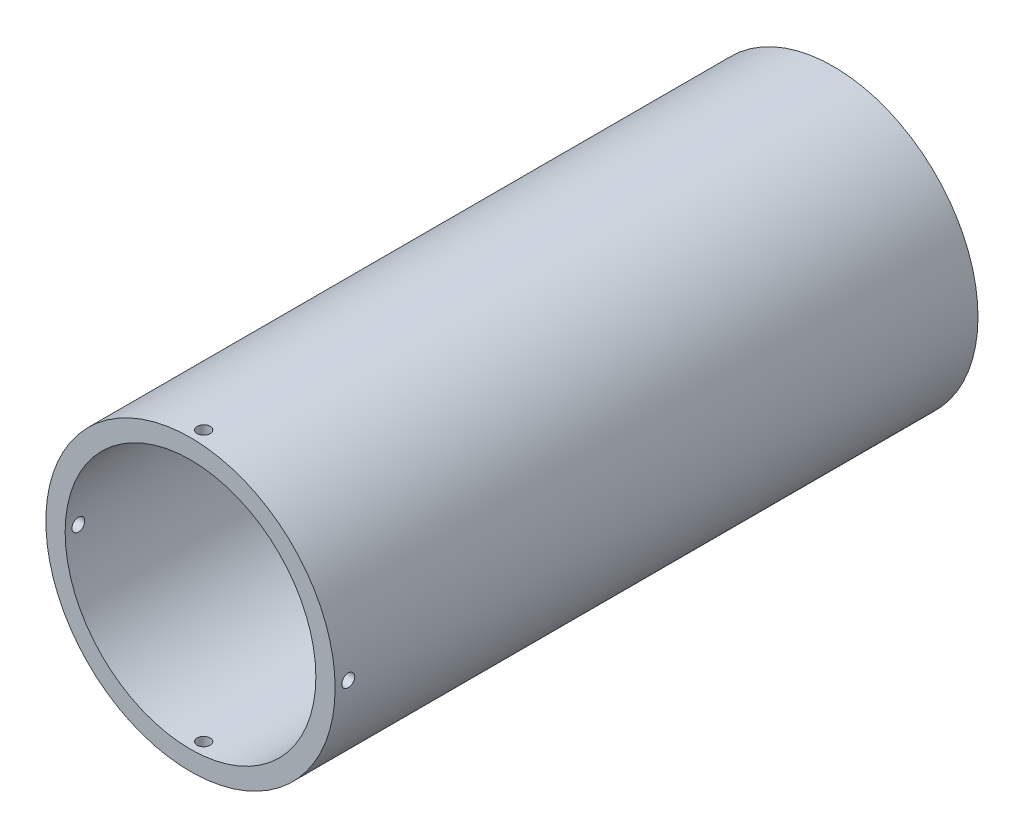
from build123d import *

# Parameters (mm, degrees)
SKETCH_1_R               = 22.5
SKETCH_1_R_2             = 19.5
EXTRUDE_1_DEPTH          = 100
SKETCH_3_R               = 1
CUT_EXTRUDE_1_DEPTH      = 25
PATTERN_CIRCULAR_1_COUNT = 4


with BuildPart() as part:
    # Эскиз1 → Бобышка-Вытянуть1 (new body)
    with BuildSketch(Plane.XY):
        Circle(SKETCH_1_R)
        Circle(SKETCH_1_R_2, mode=Mode.SUBTRACT)
    extrude(amount=EXTRUDE_1_DEPTH)

    # Эскиз3 → Вырез-Вытянуть1 (cut)
    with BuildSketch(Plane(origin=(0, 22.5, 0), x_dir=(1, 0, 0), z_dir=(0, 1, 0))):
        with Locations((0, -97.946336971)):
            Circle(SKETCH_3_R)
    cut_extrude_1 = extrude(amount=-CUT_EXTRUDE_1_DEPTH, mode=Mode.SUBTRACT)

    # Круговой массив1: Вырез-Вытянуть1 ×4 about axis
    pattern_circular_1_axis = Axis((0, 0, 100), (0, 0, -1))
    for i in range(1, PATTERN_CIRCULAR_1_COUNT):
        add(cut_extrude_1.rotate(pattern_circular_1_axis, i * 360 / PATTERN_CIRCULAR_1_COUNT), mode=Mode.SUBTRACT)


solid = part.part
